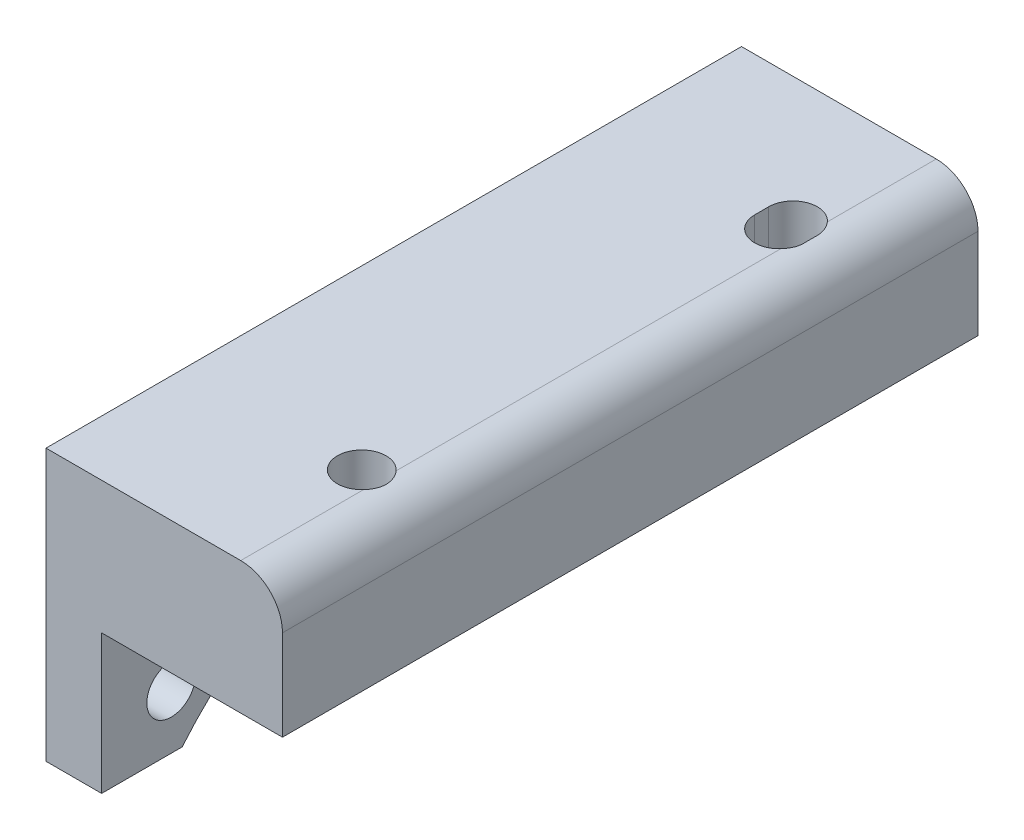
from build123d import *

# Parameters (mm, degrees)
ESQUISSE1_W             = 13
ESQUISSE1_H             = 9.5
BOSS_EXTRU_1_DEPTH      = 50
ESQUISSE2_R             = 1.75
ENL_V_MAT_EXTRU_1_DEPTH = 500
ESQUISSE3_W             = 50
ESQUISSE3_H             = 61.5
BOSS_EXTRU_2_DEPTH      = 4
ESQUISSE4_R             = 1.75
ENL_V_MAT_EXTRU_2_DEPTH = 33.5
CONG_2_R                = 3
ENL_V_START             = -5
ESQUISSE5_R             = 1.75
ENL_V_MAT_EXTRU_3_DEPTH = 5


with BuildPart() as part:
    # Esquisse1 → Boss.-Extru.1 (new body)
    with BuildSketch(Plane.XY):
        with Locations((6.5, 4.75)):
            Rectangle(ESQUISSE1_W, ESQUISSE1_H)
    extrude(amount=BOSS_EXTRU_1_DEPTH)

    # Esquisse2 → Enlèv. mat.-Extru.1 (cut)
    with BuildSketch(Plane(origin=(0, 9.5, 0), x_dir=(1, 0, 0), z_dir=(0, 1, 0))):
        with Locations(Location((8.7, -40, 0), (0, 0, 270))):
            Circle(ESQUISSE2_R)
        with BuildLine():
            Line((6.95, -10), (6.95, -9))
            ThreePointArc((6.95, -9), (8.7, -7.25), (10.45, -9))
            Line((10.45, -9), (10.45, -10))
            ThreePointArc((10.45, -10), (8.7, -11.75), (6.95, -10))
        make_face()
    extrude(amount=-ENL_V_MAT_EXTRU_1_DEPTH, mode=Mode.SUBTRACT)

    # Esquisse3 → Boss.-Extru.2 (add)
    with BuildSketch(Plane.ZY):
        with Locations((25, -21.25)):
            Rectangle(ESQUISSE3_W, ESQUISSE3_H)
    extrude(amount=BOSS_EXTRU_2_DEPTH)

    # Esquisse4 → Enlèv. mat.-Extru.2 (cut)
    with BuildSketch(Plane(origin=(0, 0, 0), x_dir=(0, 0, -1), z_dir=(1, 0, 0))):
        with BuildLine():
            Line((-44.209372712, -10), (-50, -10))
            Line((-50, -10), (-50, -52))
            Line((-50, -52), (0, -52))
            Line((0, -52), (0, -10))
            Line((0, -10), (-5.790627288, -10))
            ThreePointArc((-5.790627288, -10), (-25, -1), (-44.209372712, -10))
        make_face()
        with Locations((-45, -6)):
            Circle(ESQUISSE4_R)
        with Locations((-5, -6)):
            Circle(ESQUISSE4_R)
    extrude(amount=-ENL_V_MAT_EXTRU_2_DEPTH, mode=Mode.SUBTRACT)

    # Congé2
    # the kernel refuses this fillet: 3 mm, written as the material it takes off along each edge
    with BuildSketch(Plane(origin=(13, 9.5, -7.5), x_dir=(0, -1, 0), z_dir=(0, 0, 1))) as cong_2_piece_1:
        with BuildLine():
            CenterArc((CONG_2_R, -CONG_2_R), CONG_2_R, 90, 90)
            Line((0, -CONG_2_R), (0, 0))
            Line((0, 0), (CONG_2_R, 0))
        make_face()
    extrude(amount=65, mode=Mode.SUBTRACT)

    # Esquisse5 → Enlèv. mat.-Extru.3 (cut)
    # profile 1 of 4: a face of its own
    with BuildSketch(Plane(origin=(0, 0, 0), x_dir=(-1, 0, 0), z_dir=(0, -1, 0)).offset(ENL_V_START)):
        Polygon((-5.8, -38.325684219), (-8.7, -36.651368439), (-11.6, -38.325684219), (-11.6, -41.674315781), (-8.7, -43.348631561), (-5.8, -41.674315781), align=None)
        with Locations(Location((-8.7, -40, 0), (0, 0, 222.024627579))):
            Circle(ESQUISSE5_R, mode=Mode.SUBTRACT)
    # profile 2 of 4: a face of its own
    with BuildSketch(Plane(origin=(0, 0, 0), x_dir=(-1, 0, 0), z_dir=(0, -1, 0)).offset(ENL_V_START)):
        Polygon((-11.6, -7.325684219), (-11.6, -8.325684219), (-8.7, -6.651368439), (-5.8, -8.325684219), (-5.8, -7.325684219), (-8.7, -5.651368439), align=None)
    # profile 3 of 4: a face of its own
    with BuildSketch(Plane(origin=(0, 0, 0), x_dir=(-1, 0, 0), z_dir=(0, -1, 0)).offset(ENL_V_START)):
        Polygon((-11.6, -10.674315781), (-11.6, -11.674315781), (-8.7, -13.348631561), (-5.8, -11.674315781), (-5.8, -10.674315781), (-8.7, -12.348631561), align=None)
    # profile 4 of 4: a face of its own
    with BuildSketch(Plane(origin=(0, 0, 0), x_dir=(-1, 0, 0), z_dir=(0, -1, 0)).offset(ENL_V_START)):
        Polygon((-11.6, -8.325684219), (-11.6, -10.674315781), (-8.7, -12.348631561), (-5.8, -10.674315781), (-5.8, -8.325684219), (-8.7, -6.651368439), align=None)
        with BuildLine():
            ThreePointArc((-10.45, -9), (-8.7, -7.25), (-6.95, -9))
            Line((-6.95, -9), (-6.95, -10))
            ThreePointArc((-6.95, -10), (-8.7, -11.75), (-10.45, -10))
            Line((-10.45, -10), (-10.45, -9))
        make_face(mode=Mode.SUBTRACT)
    extrude(amount=ENL_V_MAT_EXTRU_3_DEPTH, mode=Mode.SUBTRACT)


solid = part.part
